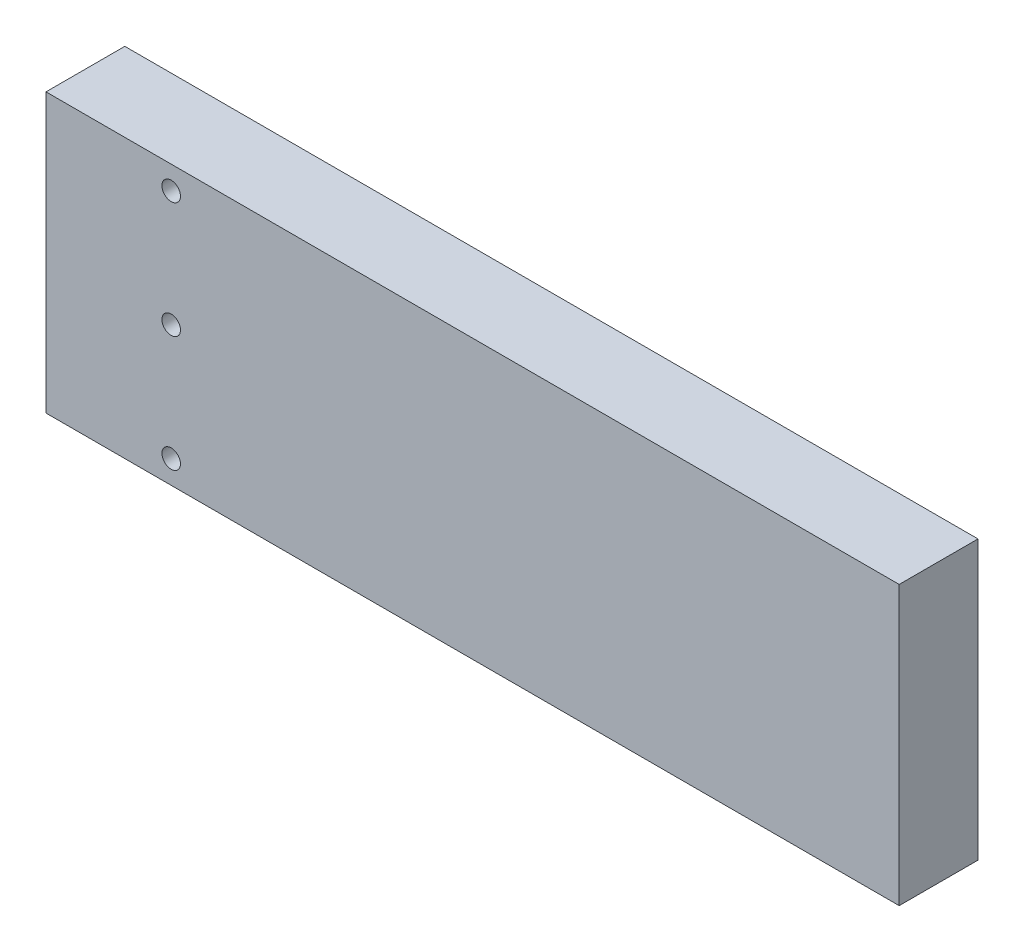
from build123d import *

# Parameters (mm, degrees)
ESQUISSE1_W        = 184
ESQUISSE1_H        = 60
ESQUISSE1_R        = 2
BOSS_EXTRU_1_DEPTH = 17


with BuildPart() as part:
    # Esquisse1 → Boss.-Extru.1 (new body)
    with BuildSketch(Plane.XY):
        with Locations((92, -30)):
            Rectangle(ESQUISSE1_W, ESQUISSE1_H)
        with Locations((27, -55)):
            Circle(ESQUISSE1_R, mode=Mode.SUBTRACT)
        with Locations((27, -30)):
            Circle(ESQUISSE1_R, mode=Mode.SUBTRACT)
        with Locations((27, -5)):
            Circle(ESQUISSE1_R, mode=Mode.SUBTRACT)
    extrude(amount=BOSS_EXTRU_1_DEPTH)


solid = part.part
